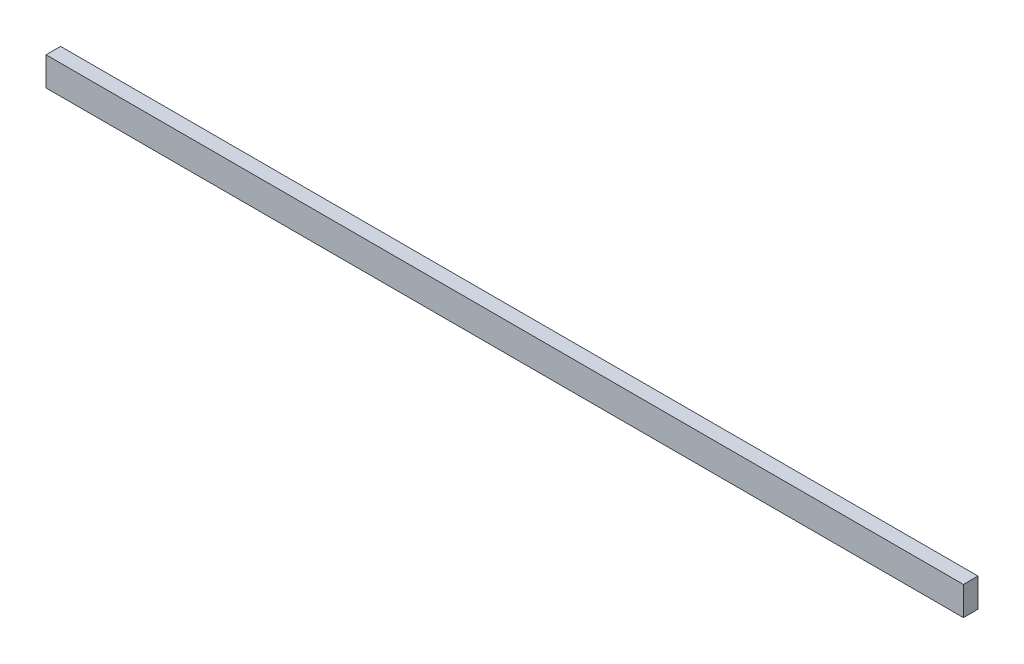
from build123d import *

# Parameters (mm, degrees)
SKETCH1_W           = 6.0452
SKETCH1_H           = 11.938
BOSS_EXTRUDE1_DEPTH = 190.5


with BuildPart() as part:
    # Sketch1 → Boss-Extrude1 (new, symmetric)
    with BuildSketch(Plane(origin=(0, 0, 0), x_dir=(0, 0, -1), z_dir=(1, 0, 0))):
        Rectangle(SKETCH1_W, SKETCH1_H)
    extrude(amount=BOSS_EXTRUDE1_DEPTH, both=True)


solid = part.part
